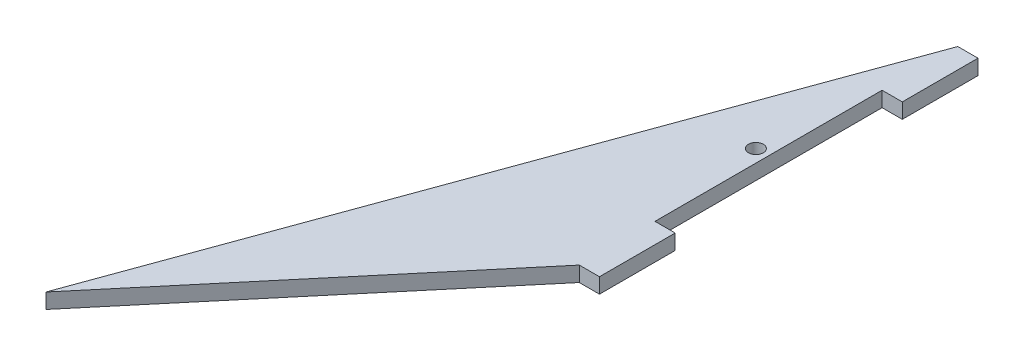
from build123d import *

# Parameters (mm, degrees)
BOSS_EXTRUDE1_DEPTH = 3
SKETCH2_W           = 15
SKETCH2_H           = 3
BOSS_EXTRUDE2_DEPTH = 4
SKETCH3_R           = 1.4732
CUT_EXTRUDE1_DEPTH  = 90.208264753


with BuildPart() as part:
    # Sketch1 → Boss-Extrude1 (new body)
    with BuildSketch(Plane(origin=(0, 0, 0), x_dir=(1, 0, 0), z_dir=(0, 1, 0))):
        Polygon((-48.209070726, -57.453333234), (0, 75), (0, 0), align=None)
    extrude(amount=BOSS_EXTRUDE1_DEPTH)

    # Sketch2 → Boss-Extrude2 (add)
    with BuildSketch(Plane(origin=(0, 0, 0), x_dir=(0, 0, -1), z_dir=(1, 0, 0))):
        with Locations((7.5, 1.5)):
            Rectangle(SKETCH2_W, SKETCH2_H)
        with Locations((67.5, 1.5)):
            Rectangle(SKETCH2_W, SKETCH2_H)
    extrude(amount=BOSS_EXTRUDE2_DEPTH)

    # Sketch3 → Cut-Extrude1 (cut, through all)
    with BuildSketch(Plane(origin=(0, 3, 0), x_dir=(1, 0, 0), z_dir=(0, 1, 0))):
        with Locations((-2.5, 37.5)):
            Circle(SKETCH3_R)
    extrude(amount=-CUT_EXTRUDE1_DEPTH, mode=Mode.SUBTRACT)


solid = part.part
